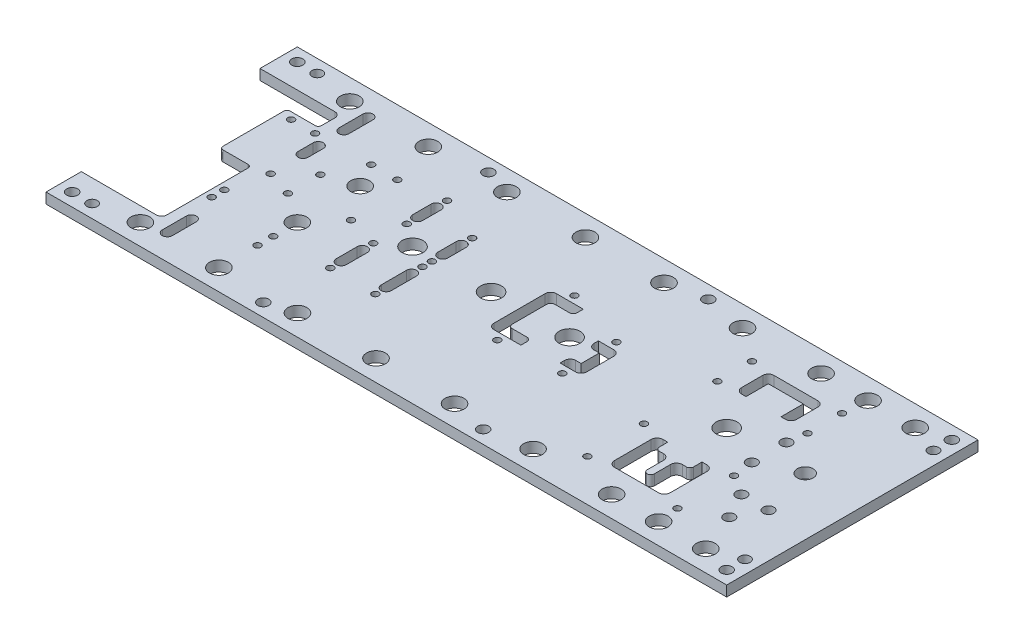
from build123d import *

# Parameters (mm, degrees)
SKETCH1_W                      = 650
SKETCH1_H                      = 240
BOSS_EXTRUDE1_DEPTH            = 10
CUT_EXTRUDE1_REACH             = 348.591
SKETCH2_R                      = 9
SKETCH2_R_2                    = 10
M6_CLEARANCE_HOLE1_D           = 6.4
M6_CLEARANCE_HOLE1_CSINK_D     = 6.45
M6_CLEARANCE_HOLE1_CSINK_ANGLE = 90
CUT_EXTRUDE2_REACH             = 348.591
FILLET1_R                      = 3
CUT_EXTRUDE3_REACH             = 348.591
SKETCH12_R                     = 5.113641914
SKETCH12_R_2                   = 7.613641914
CUT_EXTRUDE4_REACH             = 348.591
CUT_EXTRUDE5_REACH             = 348.591
CUT_EXTRUDE6_REACH             = 348.591
M10_CLEARANCE_HOLE1_D          = 10.5
F_10_0MM_DOWEL_HOLE1_D         = 10


with BuildPart() as part:
    # Sketch1 → Boss-Extrude1 (new body)
    with BuildSketch(Plane(origin=(0, 0, 0), x_dir=(1, 0, 0), z_dir=(0, 1, 0))):
        Rectangle(SKETCH1_W, SKETCH1_H)
    extrude(amount=-BOSS_EXTRUDE1_DEPTH)

    # Sketch2 → Cut-Extrude1 (cut, up to next)
    with BuildSketch(Plane.XZ.offset(10), mode=Mode.PRIVATE) as cut_extrude1_sk1:
        with Locations((-254.87, -100)):
            Circle(SKETCH2_R)
    cut_extrude1_tool1 = extrude(cut_extrude1_sk1.sketch, amount=-CUT_EXTRUDE1_REACH, mode=Mode.PRIVATE) & part.part
    # Sketch2 → Cut-Extrude1 (cut, up to next)
    with BuildSketch(Plane.XZ.offset(10), mode=Mode.PRIVATE) as cut_extrude1_sk2:
        with Locations((285, -100)):
            Circle(SKETCH2_R)
    cut_extrude1_tool2 = extrude(cut_extrude1_sk2.sketch, amount=-CUT_EXTRUDE1_REACH, mode=Mode.PRIVATE) & part.part
    # Sketch2 → Cut-Extrude1 (cut, up to next)
    with BuildSketch(Plane.XZ.offset(10), mode=Mode.PRIVATE) as cut_extrude1_sk3:
        with Locations((120.13, 100)):
            Circle(SKETCH2_R)
    cut_extrude1_tool3 = extrude(cut_extrude1_sk3.sketch, amount=-CUT_EXTRUDE1_REACH, mode=Mode.PRIVATE) & part.part
    # Sketch2 → Cut-Extrude1 (cut, up to next)
    with BuildSketch(Plane.XZ.offset(10), mode=Mode.PRIVATE) as cut_extrude1_sk4:
        with Locations((120.13, -100)):
            Circle(SKETCH2_R)
    cut_extrude1_tool4 = extrude(cut_extrude1_sk4.sketch, amount=-CUT_EXTRUDE1_REACH, mode=Mode.PRIVATE) & part.part
    # Sketch2 → Cut-Extrude1 (cut, up to next)
    with BuildSketch(Plane.XZ.offset(10), mode=Mode.PRIVATE) as cut_extrude1_sk5:
        with Locations((45.13, 100)):
            Circle(SKETCH2_R)
    cut_extrude1_tool5 = extrude(cut_extrude1_sk5.sketch, amount=-CUT_EXTRUDE1_REACH, mode=Mode.PRIVATE) & part.part
    # Sketch2 → Cut-Extrude1 (cut, up to next)
    with BuildSketch(Plane.XZ.offset(10), mode=Mode.PRIVATE) as cut_extrude1_sk6:
        with Locations((240, 100)):
            Circle(SKETCH2_R)
    cut_extrude1_tool6 = extrude(cut_extrude1_sk6.sketch, amount=-CUT_EXTRUDE1_REACH, mode=Mode.PRIVATE) & part.part
    # Sketch2 → Cut-Extrude1 (cut, up to next)
    with BuildSketch(Plane.XZ.offset(10), mode=Mode.PRIVATE) as cut_extrude1_sk7:
        with Locations((240, -100)):
            Circle(SKETCH2_R)
    cut_extrude1_tool7 = extrude(cut_extrude1_sk7.sketch, amount=-CUT_EXTRUDE1_REACH, mode=Mode.PRIVATE) & part.part
    # Sketch2 → Cut-Extrude1 (cut, up to next)
    with BuildSketch(Plane.XZ.offset(10), mode=Mode.PRIVATE) as cut_extrude1_sk8:
        with Locations((195.13, -100)):
            Circle(SKETCH2_R)
    cut_extrude1_tool8 = extrude(cut_extrude1_sk8.sketch, amount=-CUT_EXTRUDE1_REACH, mode=Mode.PRIVATE) & part.part
    # Sketch2 → Cut-Extrude1 (cut, up to next)
    with BuildSketch(Plane.XZ.offset(10), mode=Mode.PRIVATE) as cut_extrude1_sk9:
        with Locations((285, 100)):
            Circle(SKETCH2_R)
    cut_extrude1_tool9 = extrude(cut_extrude1_sk9.sketch, amount=-CUT_EXTRUDE1_REACH, mode=Mode.PRIVATE) & part.part
    # Sketch2 → Cut-Extrude1 (cut, up to next)
    with BuildSketch(Plane.XZ.offset(10), mode=Mode.PRIVATE) as cut_extrude1_sk10:
        with Locations((-104.87, -100)):
            Circle(SKETCH2_R)
    cut_extrude1_tool10 = extrude(cut_extrude1_sk10.sketch, amount=-CUT_EXTRUDE1_REACH, mode=Mode.PRIVATE) & part.part
    # Sketch2 → Cut-Extrude1 (cut, up to next)
    with BuildSketch(Plane.XZ.offset(10), mode=Mode.PRIVATE) as cut_extrude1_sk11:
        with Locations((-179.87, 100)):
            Circle(SKETCH2_R)
    cut_extrude1_tool11 = extrude(cut_extrude1_sk11.sketch, amount=-CUT_EXTRUDE1_REACH, mode=Mode.PRIVATE) & part.part
    # Sketch2 → Cut-Extrude1 (cut, up to next)
    with BuildSketch(Plane.XZ.offset(10), mode=Mode.PRIVATE) as cut_extrude1_sk12:
        with Locations((-179.87, -100)):
            Circle(SKETCH2_R)
    cut_extrude1_tool12 = extrude(cut_extrude1_sk12.sketch, amount=-CUT_EXTRUDE1_REACH, mode=Mode.PRIVATE) & part.part
    # Sketch2 → Cut-Extrude1 (cut, up to next)
    with BuildSketch(Plane.XZ.offset(10), mode=Mode.PRIVATE) as cut_extrude1_sk13:
        with Locations((45.13, -100)):
            Circle(SKETCH2_R)
    cut_extrude1_tool13 = extrude(cut_extrude1_sk13.sketch, amount=-CUT_EXTRUDE1_REACH, mode=Mode.PRIVATE) & part.part
    # Sketch2 → Cut-Extrude1 (cut, up to next)
    with BuildSketch(Plane.XZ.offset(10), mode=Mode.PRIVATE) as cut_extrude1_sk14:
        with Locations((-29.87, 100)):
            Circle(SKETCH2_R)
    cut_extrude1_tool14 = extrude(cut_extrude1_sk14.sketch, amount=-CUT_EXTRUDE1_REACH, mode=Mode.PRIVATE) & part.part
    # Sketch2 → Cut-Extrude1 (cut, up to next)
    with BuildSketch(Plane.XZ.offset(10), mode=Mode.PRIVATE) as cut_extrude1_sk15:
        with Locations((-29.87, -100)):
            Circle(SKETCH2_R)
    cut_extrude1_tool15 = extrude(cut_extrude1_sk15.sketch, amount=-CUT_EXTRUDE1_REACH, mode=Mode.PRIVATE) & part.part
    # Sketch2 → Cut-Extrude1 (cut, up to next)
    with BuildSketch(Plane.XZ.offset(10), mode=Mode.PRIVATE) as cut_extrude1_sk16:
        with Locations((-104.87, 100)):
            Circle(SKETCH2_R)
    cut_extrude1_tool16 = extrude(cut_extrude1_sk16.sketch, amount=-CUT_EXTRUDE1_REACH, mode=Mode.PRIVATE) & part.part
    # Sketch2 → Cut-Extrude1 (cut, up to next)
    with BuildSketch(Plane.XZ.offset(10), mode=Mode.PRIVATE) as cut_extrude1_sk17:
        with Locations((195.13, 100)):
            Circle(SKETCH2_R)
    cut_extrude1_tool17 = extrude(cut_extrude1_sk17.sketch, amount=-CUT_EXTRUDE1_REACH, mode=Mode.PRIVATE) & part.part
    # Sketch2 → Cut-Extrude1 (cut, up to next)
    with BuildSketch(Plane.XZ.offset(10), mode=Mode.PRIVATE) as cut_extrude1_sk18:
        with Locations((-254.87, 100)):
            Circle(SKETCH2_R)
    cut_extrude1_tool18 = extrude(cut_extrude1_sk18.sketch, amount=-CUT_EXTRUDE1_REACH, mode=Mode.PRIVATE) & part.part
    # Sketch2 → Cut-Extrude1 (cut, up to next)
    with BuildSketch(Plane.XZ.offset(10), mode=Mode.PRIVATE) as cut_extrude1_sk19:
        with Locations((195.13, -9.86)):
            Circle(SKETCH2_R_2)
    cut_extrude1_tool19 = extrude(cut_extrude1_sk19.sketch, amount=-CUT_EXTRUDE1_REACH, mode=Mode.PRIVATE) & part.part
    # Sketch2 → Cut-Extrude1 (cut, up to next)
    with BuildSketch(Plane.XZ.offset(10), mode=Mode.PRIVATE) as cut_extrude1_sk20:
        with Locations((45.13, -9.86)):
            Circle(SKETCH2_R_2)
    cut_extrude1_tool20 = extrude(cut_extrude1_sk20.sketch, amount=-CUT_EXTRUDE1_REACH, mode=Mode.PRIVATE) & part.part
    # Sketch2 → Cut-Extrude1 (cut, up to next)
    with BuildSketch(Plane.XZ.offset(10), mode=Mode.PRIVATE) as cut_extrude1_sk21:
        with Locations((-29.87, -9.86)):
            Circle(SKETCH2_R_2)
    cut_extrude1_tool21 = extrude(cut_extrude1_sk21.sketch, amount=-CUT_EXTRUDE1_REACH, mode=Mode.PRIVATE) & part.part
    # Sketch2 → Cut-Extrude1 (cut, up to next)
    with BuildSketch(Plane.XZ.offset(10), mode=Mode.PRIVATE) as cut_extrude1_sk22:
        with Locations((-104.87, -9.86)):
            Circle(SKETCH2_R_2)
    cut_extrude1_tool22 = extrude(cut_extrude1_sk22.sketch, amount=-CUT_EXTRUDE1_REACH, mode=Mode.PRIVATE) & part.part
    # Sketch2 → Cut-Extrude1 (cut, up to next)
    with BuildSketch(Plane.XZ.offset(10), mode=Mode.PRIVATE) as cut_extrude1_sk23:
        with Locations((-179.87, 25.14)):
            Circle(SKETCH2_R)
    cut_extrude1_tool23 = extrude(cut_extrude1_sk23.sketch, amount=-CUT_EXTRUDE1_REACH, mode=Mode.PRIVATE) & part.part
    # Sketch2 → Cut-Extrude1 (cut, up to next)
    with BuildSketch(Plane.XZ.offset(10), mode=Mode.PRIVATE) as cut_extrude1_sk24:
        with Locations((-179.87, -34.86)):
            Circle(SKETCH2_R)
    cut_extrude1_tool24 = extrude(cut_extrude1_sk24.sketch, amount=-CUT_EXTRUDE1_REACH, mode=Mode.PRIVATE) & part.part
    add(cut_extrude1_tool1.solids().sort_by_distance((-254.87, -10, -100))[0], mode=Mode.SUBTRACT)
    add(cut_extrude1_tool2.solids().sort_by_distance((285, -10, -100))[0], mode=Mode.SUBTRACT)
    add(cut_extrude1_tool3.solids().sort_by_distance((120.13, -10, 100))[0], mode=Mode.SUBTRACT)
    add(cut_extrude1_tool4.solids().sort_by_distance((120.13, -10, -100))[0], mode=Mode.SUBTRACT)
    add(cut_extrude1_tool5.solids().sort_by_distance((45.13, -10, 100))[0], mode=Mode.SUBTRACT)
    add(cut_extrude1_tool6.solids().sort_by_distance((240, -10, 100))[0], mode=Mode.SUBTRACT)
    add(cut_extrude1_tool7.solids().sort_by_distance((240, -10, -100))[0], mode=Mode.SUBTRACT)
    add(cut_extrude1_tool8.solids().sort_by_distance((195.13, -10, -100))[0], mode=Mode.SUBTRACT)
    add(cut_extrude1_tool9.solids().sort_by_distance((285, -10, 100))[0], mode=Mode.SUBTRACT)
    add(cut_extrude1_tool10.solids().sort_by_distance((-104.87, -10, -100))[0], mode=Mode.SUBTRACT)
    add(cut_extrude1_tool11.solids().sort_by_distance((-179.87, -10, 100))[0], mode=Mode.SUBTRACT)
    add(cut_extrude1_tool12.solids().sort_by_distance((-179.87, -10, -100))[0], mode=Mode.SUBTRACT)
    add(cut_extrude1_tool13.solids().sort_by_distance((45.13, -10, -100))[0], mode=Mode.SUBTRACT)
    add(cut_extrude1_tool14.solids().sort_by_distance((-29.87, -10, 100))[0], mode=Mode.SUBTRACT)
    add(cut_extrude1_tool15.solids().sort_by_distance((-29.87, -10, -100))[0], mode=Mode.SUBTRACT)
    add(cut_extrude1_tool16.solids().sort_by_distance((-104.87, -10, 100))[0], mode=Mode.SUBTRACT)
    add(cut_extrude1_tool17.solids().sort_by_distance((195.13, -10, 100))[0], mode=Mode.SUBTRACT)
    add(cut_extrude1_tool18.solids().sort_by_distance((-254.87, -10, 100))[0], mode=Mode.SUBTRACT)
    add(cut_extrude1_tool19.solids().sort_by_distance((195.13, -10, -9.86))[0], mode=Mode.SUBTRACT)
    add(cut_extrude1_tool20.solids().sort_by_distance((45.13, -10, -9.86))[0], mode=Mode.SUBTRACT)
    add(cut_extrude1_tool21.solids().sort_by_distance((-29.87, -10, -9.86))[0], mode=Mode.SUBTRACT)
    add(cut_extrude1_tool22.solids().sort_by_distance((-104.87, -10, -9.86))[0], mode=Mode.SUBTRACT)
    add(cut_extrude1_tool23.solids().sort_by_distance((-179.87, -10, 25.14))[0], mode=Mode.SUBTRACT)
    add(cut_extrude1_tool24.solids().sort_by_distance((-179.87, -10, -34.86))[0], mode=Mode.SUBTRACT)

    # M6 Clearance Hole1 (through all)
    with Locations(Plane(origin=(0, -10, 0), x_dir=(-1, 0, 0), z_dir=(0, -1, 0))):
        with Locations((-238.13, -26.14), (-152.13, -26.14), (-152.13, -80.14), (-238.13, -80.14), (-238.13, 77), (-152.13, 77), (-152.13, 44), (-238.13, 44), (-71.5, -23.486173195), (-71.5, 28.206173195), (-12.94, -26.986173195), (-12.94, 46.706173195), (83.37, 45.36), (83.37, 6.86), (126.37, 25.86), (126.37, 64.36), (83.37, -2.14), (126.37, -6.14), (126.37, -47.14), (83.37, -47.14), (156.12, 2.36), (208.37, -5.64), (208.37, 25.36), (192.37, 57.86), (167.37, 57.86), (179.87, -48.14), (179.87, -63.14), (241.62, -33.14), (241.62, -45.14), (232.87, 2.36), (267.87, 56.92), (245.000667118, 56.92)):
            CounterSinkHole(M6_CLEARANCE_HOLE1_D / 2, M6_CLEARANCE_HOLE1_CSINK_D / 2, counter_sink_angle=M6_CLEARANCE_HOLE1_CSINK_ANGLE)

    # Sketch8 → Cut-Extrude2 (cut, up to next)
    with BuildSketch(Plane(origin=(0, 0, 0), x_dir=(1, 0, 0), z_dir=(0, 1, 0)), mode=Mode.PRIVATE) as cut_extrude2_sk1:
        with BuildLine():
            Line((-325, -86.262387825), (-253.37, -86.262387825))
            ThreePointArc((-253.37, -86.262387825), (-249.834466094, -84.797921731), (-248.37, -81.262387825))
            Line((-248.37, -81.262387825), (-248.37, -3.64))
            ThreePointArc((-248.37, -3.64), (-249.248679656, -1.518679656), (-251.37, -0.64))
            Line((-251.37, -0.64), (-275.37, -0.64))
            ThreePointArc((-275.37, -0.64), (-277.491320344, 0.238679656), (-278.37, 2.36))
            Line((-278.37, 2.36), (-278.37, 63.48))
            Line((-278.37, 63.48), (-248.37, 63.48))
            Line((-248.37, 63.48), (-248.37, 79.36))
            ThreePointArc((-248.37, 79.36), (-249.834466094, 82.895533906), (-253.37, 84.36))
            Line((-253.37, 84.36), (-325, 84.36))
            Line((-325, 84.36), (-325, -86.262387825))
        make_face()
    cut_extrude2_tool1 = extrude(cut_extrude2_sk1.sketch, amount=-CUT_EXTRUDE2_REACH, mode=Mode.PRIVATE) & part.part
    add(cut_extrude2_tool1.solids().sort_by_distance((-290.751548, 0, 6.540426))[0], mode=Mode.SUBTRACT)

    # Fillet1
    fillet1_edges = [part.edges().sort_by_distance(p)[0] for p in [
        (-248.37, -5, -63.48),
        (-278.37, -5, -63.48),
    ]]
    fillet(fillet1_edges, radius=FILLET1_R)

    # Sketch12 → Cut-Extrude3 (cut, up to next)
    with BuildSketch(Plane.XZ.offset(10), mode=Mode.PRIVATE) as cut_extrude3_sk1:
        with Locations((270.13, 62.64)):
            Circle(SKETCH12_R)
    cut_extrude3_tool1 = extrude(cut_extrude3_sk1.sketch, amount=-CUT_EXTRUDE3_REACH, mode=Mode.PRIVATE) & part.part
    # Sketch12 → Cut-Extrude3 (cut, up to next)
    with BuildSketch(Plane.XZ.offset(10), mode=Mode.PRIVATE) as cut_extrude3_sk2:
        with Locations((283.13, 38.14)):
            Circle(SKETCH12_R)
    cut_extrude3_tool2 = extrude(cut_extrude3_sk2.sketch, amount=-CUT_EXTRUDE3_REACH, mode=Mode.PRIVATE) & part.part
    # Sketch12 → Cut-Extrude3 (cut, up to next)
    with BuildSketch(Plane.XZ.offset(10), mode=Mode.PRIVATE) as cut_extrude3_sk3:
        with Locations((257.13, 38.14)):
            Circle(SKETCH12_R)
    cut_extrude3_tool3 = extrude(cut_extrude3_sk3.sketch, amount=-CUT_EXTRUDE3_REACH, mode=Mode.PRIVATE) & part.part
    # Sketch12 → Cut-Extrude3 (cut, up to next)
    with BuildSketch(Plane.XZ.offset(10), mode=Mode.PRIVATE) as cut_extrude3_sk4:
        with Locations((270.13, -9.86)):
            Circle(SKETCH12_R_2)
    cut_extrude3_tool4 = extrude(cut_extrude3_sk4.sketch, amount=-CUT_EXTRUDE3_REACH, mode=Mode.PRIVATE) & part.part
    # Sketch12 → Cut-Extrude3 (cut, up to next)
    with BuildSketch(Plane.XZ.offset(10), mode=Mode.PRIVATE) as cut_extrude3_sk5:
        with Locations((235.63, -26.36)):
            Circle(SKETCH12_R)
    cut_extrude3_tool5 = extrude(cut_extrude3_sk5.sketch, amount=-CUT_EXTRUDE3_REACH, mode=Mode.PRIVATE) & part.part
    # Sketch12 → Cut-Extrude3 (cut, up to next)
    with BuildSketch(Plane.XZ.offset(10), mode=Mode.PRIVATE) as cut_extrude3_sk6:
        with Locations((235.63, 6.64)):
            Circle(SKETCH12_R)
    cut_extrude3_tool6 = extrude(cut_extrude3_sk6.sketch, amount=-CUT_EXTRUDE3_REACH, mode=Mode.PRIVATE) & part.part
    # Sketch12 → Cut-Extrude3 (cut, up to next)
    with BuildSketch(Plane.XZ.offset(10), mode=Mode.PRIVATE) as cut_extrude3_sk7:
        with BuildLine():
            Line((211.837653611, -45.067653611), (211.837653611, -66.347653611))
            Line((211.837653611, -66.347653611), (178.422346389, -66.347653611))
            Line((178.422346389, -66.347653611), (178.422346389, -45.067653611))
            Line((178.422346389, -45.067653611), (174.13, -45.067653611))
            ThreePointArc((174.13, -45.067653611), (170.38774598, -46.61774598), (168.837653611, -50.36))
            Line((168.837653611, -50.36), (168.837653611, -70.64))
            ThreePointArc((168.837653611, -70.64), (170.38774598, -74.38225402), (174.13, -75.932346389))
            Line((174.13, -75.932346389), (195.13, -75.932346389))
            Line((195.13, -75.932346389), (216.13, -75.932346389))
            ThreePointArc((216.13, -75.932346389), (219.87225402, -74.38225402), (221.422346389, -70.64))
            Line((221.422346389, -70.64), (221.422346389, -50.36))
            ThreePointArc((221.422346389, -50.36), (219.87225402, -46.61774598), (216.13, -45.067653611))
            Line((216.13, -45.067653611), (211.837653611, -45.067653611))
        make_face()
    cut_extrude3_tool7 = extrude(cut_extrude3_sk7.sketch, amount=-CUT_EXTRUDE3_REACH, mode=Mode.PRIVATE) & part.part
    # Sketch12 → Cut-Extrude3 (cut, up to next)
    with BuildSketch(Plane.XZ.offset(10), mode=Mode.PRIVATE) as cut_extrude3_sk8:
        with BuildLine():
            Line((211.516358086, 30.026358086), (216.13, 30.026358086))
            ThreePointArc((216.13, 30.026358086), (220.099444264, 31.670555736), (221.743641914, 35.64))
            Line((221.743641914, 35.64), (221.743641914, 53.14))
            Line((221.743641914, 53.14), (221.743641914, 70.64))
            ThreePointArc((221.743641914, 70.64), (220.099444264, 74.609444264), (216.13, 76.253641914))
            Line((216.13, 76.253641914), (174.13, 76.253641914))
            ThreePointArc((174.13, 76.253641914), (170.160555736, 74.609444264), (168.516358086, 70.64))
            Line((168.516358086, 70.64), (168.516358086, 35.64))
            ThreePointArc((168.516358086, 35.64), (170.160555736, 31.670555736), (174.13, 30.026358086))
            Line((174.13, 30.026358086), (178.743641914, 30.026358086))
            Line((178.743641914, 30.026358086), (178.743641914, 38.14))
            ThreePointArc((178.743641914, 38.14), (179.735483234, 40.534516766), (182.13, 41.526358086))
            Line((182.13, 41.526358086), (186.13, 41.526358086))
            ThreePointArc((186.13, 41.526358086), (190.099444264, 43.170555736), (191.743641914, 47.14))
            Line((191.743641914, 47.14), (191.743641914, 62.64))
            ThreePointArc((191.743641914, 62.64), (195.13, 66.026358086), (198.516358086, 62.64))
            Line((198.516358086, 62.64), (198.516358086, 47.14))
            ThreePointArc((198.516358086, 47.14), (200.160555736, 43.170555736), (204.13, 41.526358086))
            Line((204.13, 41.526358086), (208.13, 41.526358086))
            ThreePointArc((208.13, 41.526358086), (210.524516766, 40.534516766), (211.516358086, 38.14))
            Line((211.516358086, 38.14), (211.516358086, 30.026358086))
        make_face()
    cut_extrude3_tool8 = extrude(cut_extrude3_sk8.sketch, amount=-CUT_EXTRUDE3_REACH, mode=Mode.PRIVATE) & part.part
    add(cut_extrude3_tool1.solids().sort_by_distance((270.13, -10, 62.64))[0], mode=Mode.SUBTRACT)
    add(cut_extrude3_tool2.solids().sort_by_distance((283.13, -10, 38.14))[0], mode=Mode.SUBTRACT)
    add(cut_extrude3_tool3.solids().sort_by_distance((257.13, -10, 38.14))[0], mode=Mode.SUBTRACT)
    add(cut_extrude3_tool4.solids().sort_by_distance((270.13, -10, -9.86))[0], mode=Mode.SUBTRACT)
    add(cut_extrude3_tool5.solids().sort_by_distance((235.63, -10, -26.36))[0], mode=Mode.SUBTRACT)
    add(cut_extrude3_tool6.solids().sort_by_distance((235.63, -10, 6.64))[0], mode=Mode.SUBTRACT)
    add(cut_extrude3_tool7.solids().sort_by_distance((205.63, -10, -75.32261))[0], mode=Mode.SUBTRACT)
    add(cut_extrude3_tool8.solids().sort_by_distance((206.13, -10, 42.231348))[0], mode=Mode.SUBTRACT)

    # Sketch13 → Cut-Extrude4 (cut, up to next)
    with BuildSketch(Plane.XZ.offset(10), mode=Mode.PRIVATE) as cut_extrude4_sk1:
        with BuildLine():
            Line((61.837653611, 15.932346389), (61.837653611, 11.64))
            ThreePointArc((61.837653611, 11.64), (63.38774598, 7.89774598), (67.13, 6.347653611))
            Line((67.13, 6.347653611), (72.337653611, 6.347653611))
            Line((72.337653611, 6.347653611), (72.337653611, -11.067653611))
            Line((72.337653611, -11.067653611), (67.13, -11.067653611))
            ThreePointArc((67.13, -11.067653611), (63.38774598, -12.61774598), (61.837653611, -16.36))
            Line((61.837653611, -16.36), (61.837653611, -20.652346389))
            Line((61.837653611, -20.652346389), (76.63, -20.652346389))
            ThreePointArc((76.63, -20.652346389), (80.37225402, -19.10225402), (81.922346389, -15.36))
            Line((81.922346389, -15.36), (81.922346389, -2.36))
            Line((81.922346389, -2.36), (81.922346389, 10.64))
            ThreePointArc((81.922346389, 10.64), (80.37225402, 14.38225402), (76.63, 15.932346389))
            Line((76.63, 15.932346389), (61.837653611, 15.932346389))
        make_face()
    cut_extrude4_tool1 = extrude(cut_extrude4_sk1.sketch, amount=-CUT_EXTRUDE4_REACH, mode=Mode.PRIVATE) & part.part
    # Sketch13 → Cut-Extrude4 (cut, up to next)
    with BuildSketch(Plane.XZ.offset(10), mode=Mode.PRIVATE) as cut_extrude4_sk2:
        with BuildLine():
            Line((2.63, -39.652346389), (28.422346389, -39.652346389))
            Line((28.422346389, -39.652346389), (28.422346389, -33.86))
            ThreePointArc((28.422346389, -33.86), (27.311593849, -31.178406151), (24.63, -30.067653611))
            Line((24.63, -30.067653611), (10.63, -30.067653611))
            ThreePointArc((10.63, -30.067653611), (8.00829299, -28.98170701), (6.922346389, -26.36))
            Line((6.922346389, -26.36), (6.922346389, 6.64))
            ThreePointArc((6.922346389, 6.64), (8.00829299, 9.26170701), (10.63, 10.347653611))
            Line((10.63, 10.347653611), (24.63, 10.347653611))
            ThreePointArc((24.63, 10.347653611), (27.311593849, 11.458406151), (28.422346389, 14.14))
            Line((28.422346389, 14.14), (28.422346389, 19.932346389))
            Line((28.422346389, 19.932346389), (2.63, 19.932346389))
            ThreePointArc((2.63, 19.932346389), (-1.11225402, 18.38225402), (-2.662346389, 14.64))
            Line((-2.662346389, 14.64), (-2.662346389, -13.23))
            Line((-2.662346389, -13.23), (-2.662346389, -34.36))
            ThreePointArc((-2.662346389, -34.36), (-1.11225402, -38.10225402), (2.63, -39.652346389))
        make_face()
    cut_extrude4_tool2 = extrude(cut_extrude4_sk2.sketch, amount=-CUT_EXTRUDE4_REACH, mode=Mode.PRIVATE) & part.part
    add(cut_extrude4_tool1.solids().sort_by_distance((73.54007, -10, -2.36))[0], mode=Mode.SUBTRACT)
    add(cut_extrude4_tool2.solids().sort_by_distance((-0.637039, -10, -37.627039))[0], mode=Mode.SUBTRACT)

    # Sketch14 → Cut-Extrude5 (cut, up to next)
    with BuildSketch(Plane.XZ.offset(10), mode=Mode.PRIVATE) as cut_extrude5_sk1:
        with BuildLine():
            Line((-88.162346389, -17.31), (-88.162346389, -34.91))
            ThreePointArc((-88.162346389, -34.91), (-83.37, -39.702346389), (-78.577653611, -34.91))
            Line((-78.577653611, -34.91), (-78.577653611, -26.11))
            Line((-78.577653611, -26.11), (-78.577653611, -17.31))
            ThreePointArc((-78.577653611, -17.31), (-83.37, -12.517653611), (-88.162346389, -17.31))
        make_face()
    cut_extrude5_tool1 = extrude(cut_extrude5_sk1.sketch, amount=-CUT_EXTRUDE5_REACH, mode=Mode.PRIVATE) & part.part
    # Sketch14 → Cut-Extrude5 (cut, up to next)
    with BuildSketch(Plane.XZ.offset(10), mode=Mode.PRIVATE) as cut_extrude5_sk2:
        with BuildLine():
            Line((-78.577653611, 12.59), (-78.577653611, 24.64))
            Line((-78.577653611, 24.64), (-78.577653611, 36.69))
            ThreePointArc((-78.577653611, 36.69), (-83.37, 41.482346389), (-88.162346389, 36.69))
            Line((-88.162346389, 36.69), (-88.162346389, 12.59))
            ThreePointArc((-88.162346389, 12.59), (-83.37, 7.797653611), (-78.577653611, 12.59))
        make_face()
    cut_extrude5_tool2 = extrude(cut_extrude5_sk2.sketch, amount=-CUT_EXTRUDE5_REACH, mode=Mode.PRIVATE) & part.part
    # Sketch14 → Cut-Extrude5 (cut, up to next)
    with BuildSketch(Plane.XZ.offset(10), mode=Mode.PRIVATE) as cut_extrude5_sk3:
        with BuildLine():
            Line((-131.232166649, 36.69), (-131.232166649, 16.59))
            ThreePointArc((-131.232166649, 16.59), (-126.37, 11.727833351), (-121.507833351, 16.59))
            Line((-121.507833351, 16.59), (-121.507833351, 26.64))
            Line((-121.507833351, 26.64), (-121.507833351, 36.69))
            ThreePointArc((-121.507833351, 36.69), (-126.37, 41.552166649), (-131.232166649, 36.69))
        make_face()
    cut_extrude5_tool3 = extrude(cut_extrude5_sk3.sketch, amount=-CUT_EXTRUDE5_REACH, mode=Mode.PRIVATE) & part.part
    # Sketch14 → Cut-Extrude5 (cut, up to next)
    with BuildSketch(Plane.XZ.offset(10), mode=Mode.PRIVATE) as cut_extrude5_sk4:
        with BuildLine():
            Line((-131.162346389, -36.31), (-131.162346389, -53.91))
            ThreePointArc((-131.162346389, -53.91), (-126.37, -58.702346389), (-121.577653611, -53.91))
            Line((-121.577653611, -53.91), (-121.577653611, -45.11))
            Line((-121.577653611, -45.11), (-121.577653611, -36.31))
            ThreePointArc((-121.577653611, -36.31), (-126.37, -31.517653611), (-131.162346389, -36.31))
        make_face()
    cut_extrude5_tool4 = extrude(cut_extrude5_sk4.sketch, amount=-CUT_EXTRUDE5_REACH, mode=Mode.PRIVATE) & part.part
    add(cut_extrude5_tool1.solids().sort_by_distance((-83.37, -10, -26.11))[0], mode=Mode.SUBTRACT)
    add(cut_extrude5_tool2.solids().sort_by_distance((-83.37, -10, 24.64))[0], mode=Mode.SUBTRACT)
    add(cut_extrude5_tool3.solids().sort_by_distance((-126.37, -10, 26.64))[0], mode=Mode.SUBTRACT)
    add(cut_extrude5_tool4.solids().sort_by_distance((-126.37, -10, -45.11))[0], mode=Mode.SUBTRACT)

    # Sketch15 → Cut-Extrude6 (cut, up to next)
    with BuildSketch(Plane.XZ.offset(10), mode=Mode.PRIVATE) as cut_extrude6_sk1:
        with BuildLine():
            Line((-228.577653611, -95.77), (-228.577653611, -84.32))
            Line((-228.577653611, -84.32), (-228.577653611, -72.87))
            ThreePointArc((-228.577653611, -72.87), (-233.37, -68.077653611), (-238.162346389, -72.87))
            Line((-238.162346389, -72.87), (-238.162346389, -95.77))
            ThreePointArc((-238.162346389, -95.77), (-233.37, -100.562346389), (-228.577653611, -95.77))
        make_face()
    cut_extrude6_tool1 = extrude(cut_extrude6_sk1.sketch, amount=-CUT_EXTRUDE6_REACH, mode=Mode.PRIVATE) & part.part
    # Sketch15 → Cut-Extrude6 (cut, up to next)
    with BuildSketch(Plane.XZ.offset(10), mode=Mode.PRIVATE) as cut_extrude6_sk2:
        with BuildLine():
            Line((-238.162346389, -33.86), (-238.162346389, -48.36))
            ThreePointArc((-238.162346389, -48.36), (-233.37, -53.152346389), (-228.577653611, -48.36))
            Line((-228.577653611, -48.36), (-228.577653611, -41.11))
            Line((-228.577653611, -41.11), (-228.577653611, -33.86))
            ThreePointArc((-228.577653611, -33.86), (-233.37, -29.067653611), (-238.162346389, -33.86))
        make_face()
    cut_extrude6_tool2 = extrude(cut_extrude6_sk2.sketch, amount=-CUT_EXTRUDE6_REACH, mode=Mode.PRIVATE) & part.part
    # Sketch15 → Cut-Extrude6 (cut, up to next)
    with BuildSketch(Plane.XZ.offset(10), mode=Mode.PRIVATE) as cut_extrude6_sk3:
        with BuildLine():
            Line((-238.162346389, 95.77), (-238.162346389, 72.87))
            ThreePointArc((-238.162346389, 72.87), (-233.37, 68.077653611), (-228.577653611, 72.87))
            Line((-228.577653611, 72.87), (-228.577653611, 84.32))
            Line((-228.577653611, 84.32), (-228.577653611, 95.77))
            ThreePointArc((-228.577653611, 95.77), (-233.37, 100.562346389), (-238.162346389, 95.77))
        make_face()
    cut_extrude6_tool3 = extrude(cut_extrude6_sk3.sketch, amount=-CUT_EXTRUDE6_REACH, mode=Mode.PRIVATE) & part.part
    add(cut_extrude6_tool1.solids().sort_by_distance((-233.37, -10, -84.32))[0], mode=Mode.SUBTRACT)
    add(cut_extrude6_tool2.solids().sort_by_distance((-233.37, -10, -41.11))[0], mode=Mode.SUBTRACT)
    add(cut_extrude6_tool3.solids().sort_by_distance((-233.37, -10, 84.32))[0], mode=Mode.SUBTRACT)

    # M10 Clearance Hole1 (through all)
    with Locations(Plane(origin=(0, -10, 0), x_dir=(-1, 0, 0), z_dir=(0, -1, 0))):
        with Locations((-312.5, 107.5), (-312.5, -107.5), (-80, 107.5), (130, 107.5), (312.5, 107.5), (312.5, -107.5), (130, -107.5), (-80, -107.5)):
            Hole(M10_CLEARANCE_HOLE1_D / 2)

    # Ø10.0mm Dowel Hole1 (through all)
    with Locations(Plane(origin=(0, -10, 0), x_dir=(-1, 0, 0), z_dir=(0, -1, 0))):
        with Locations((-312.5, 90), (-312.5, -90), (293.5, -107.5), (293.5, 107.5)):
            Hole(F_10_0MM_DOWEL_HOLE1_D / 2)


solid = part.part
